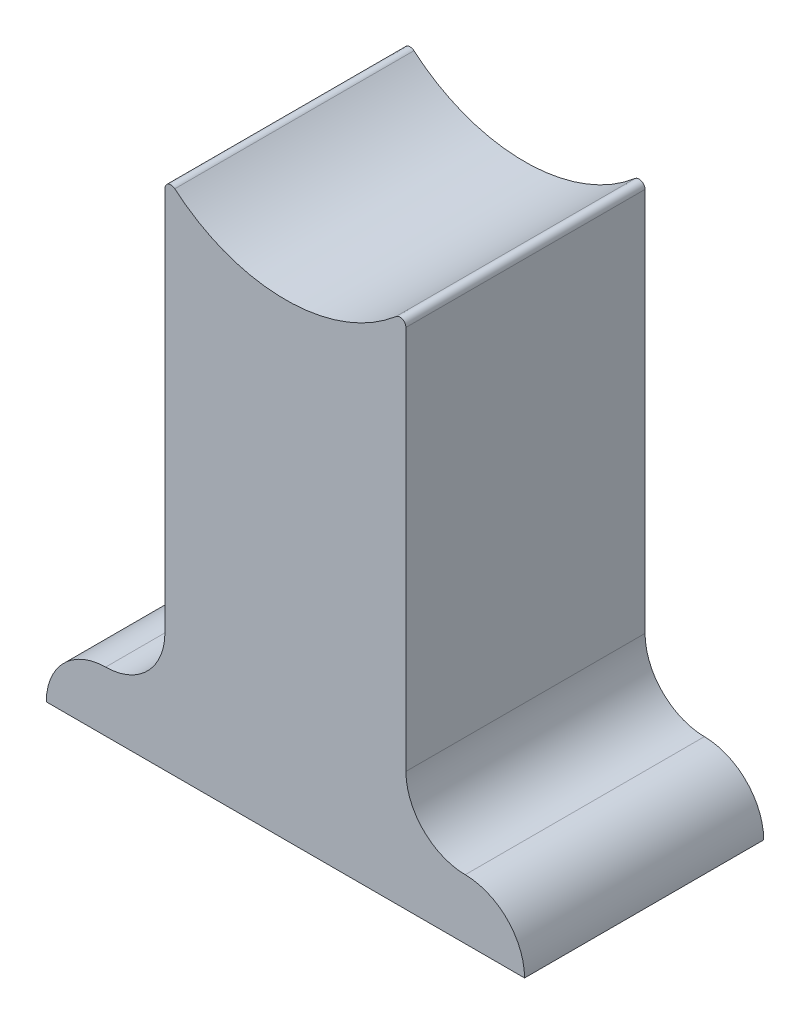
from build123d import *

# Parameters (mm, degrees)
EXTRUDE_1_DEPTH = 40
FILLET_1_R      = 1
FILLET_2_R      = 10
FILLET_3_R      = 10
SHELL_START     = 1
SHELL_1_DEPTH   = 38


# Read off the part's stored shape, not the designer's step: 抽壳1
with BuildPart() as part:
    # 草图1 → 凸台-拉伸1 (new body)
    with BuildSketch(Plane.XY):
        with BuildLine():
            Line((-40, -106.75), (40, -106.75))
            Line((40, -106.75), (40, -96.75))
            Line((40, -96.75), (20.152543264, -96.75))
            Line((20.152543264, -96.75), (20.152543264, -20.152543264))
            ThreePointArc((20.152543264, -20.152543264), (0, -28.5), (-20.152543264, -20.152543264))
            Line((-20.152543264, -20.152543264), (-20.152543264, -96.75))
            Line((-20.152543264, -96.75), (-40, -96.75))
            Line((-40, -96.75), (-40, -106.75))
        make_face()
    extrude(amount=EXTRUDE_1_DEPTH)

    # 圆角1
    fillet_1_edges = [part.edges().sort_by_distance(p)[0] for p in [
        (-20.152543264, -20.152543264, 20),
        (20.152543264, -20.152543264, 20),
    ]]
    fillet(fillet_1_edges, radius=FILLET_1_R)

    # 圆角2
    fillet_2_edges = [part.edges().sort_by_distance(p)[0] for p in [
        (40, -96.75, 20),
        (-40, -96.75, 20),
    ]]
    fillet(fillet_2_edges, radius=FILLET_2_R - 0.0001)  # a hair under: the kernel refuses the full size

    # 圆角3
    fillet_3_edges = [part.edges().sort_by_distance(p)[0] for p in [
        (20.152543264, -96.75, 20),
        (-20.152543264, -96.75, 20),
    ]]
    fillet(fillet_3_edges, radius=FILLET_3_R)

    # 抽壳1 outline → 抽壳1 (cut)
    with BuildSketch(Plane.XY.offset(SHELL_START)):
        with BuildLine():
            Line((19.152543264, -86.750581745), (19.152543264, -22.437247749))
            ThreePointArc((19.152543264, -22.437247749), (0, -29.5), (-19.152543264, -22.437247749))
            Line((-19.152543264, -22.437247749), (-19.152543264, -86.750581745))
            ThreePointArc((-19.152543264, -86.750581745), (-22.344762313, -94.499036857), (-30.068644469, -97.750261785))
            ThreePointArc((-30.068644469, -97.750261785), (-36.388184414, -100.410354908), (-39, -106.75))
            Line((-39, -106.75), (39, -106.75))
            ThreePointArc((39, -106.75), (36.388184414, -100.410354908), (30.068644469, -97.750261785))
            ThreePointArc((30.068644469, -97.750261785), (22.344762313, -94.499036857), (19.152543264, -86.750581745))
        make_face()
    extrude(amount=SHELL_1_DEPTH, mode=Mode.SUBTRACT)


solid = part.part
